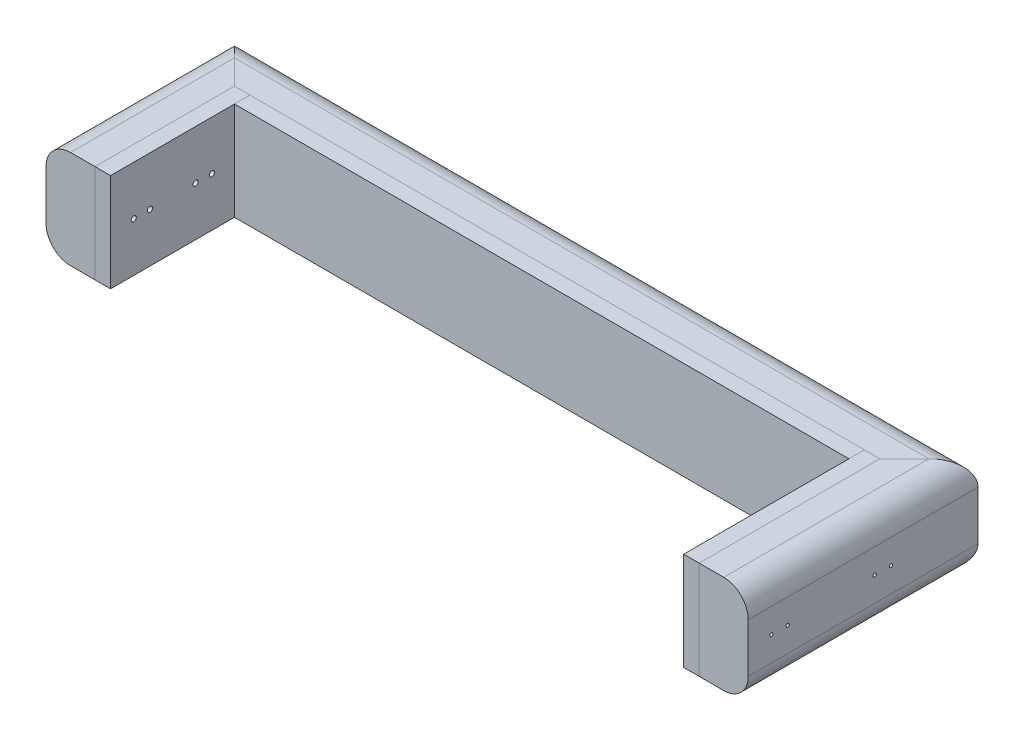
from build123d import *

# Parameters (mm, degrees)
SKETCH1_W                                     = 755.65
SKETCH1_H                                     = 19.05
BOSS_EXTRUDE1_DEPTH                           = 60.325
SKETCH2_W                                     = 19.05
SKETCH2_H                                     = 171.45
BOSS_EXTRUDE2_DEPTH                           = 60.325
SKETCH2_H_2                                   = 222.25
BOSS_EXTRUDE2_2_DEPTH                         = 60.325
CBORE_START                                   = -457.2
CBORE_FOR_0_BINDING_HEAD_MACHINE_SC_2_R       = 1.999996
CBORE_FOR_0_BINDING_HEAD_MACHINE_SCREW1_DEPTH = 914.4
CBORE_FOR_0_BINDING_HEAD_MACHINE_SC_3_O_R     = 1.999996
CBORE_FOR_0_BINDING_HEAD_MACHINE_SC_3_DEPTH   = 79.375
CBORE_START_2                                 = -382.5875
CBORE_FOR_0_BINDING_HEAD_MACHINE_SC_4_O_R     = 3.175
CBORE_FOR_0_BINDING_HEAD_MACHINE_SC_4_O_R_2   = 1.999996
CBORE_FOR_0_BINDING_HEAD_MACHINE_SC_4_DEPTH   = 765.175
CBORE_FOR_0_BINDING_HEAD_MACHINE_SC_5_O_R     = 3.175
CBORE_FOR_0_BINDING_HEAD_MACHINE_SC_5_O_R_2   = 1.999996
CBORE_FOR_0_BINDING_HEAD_MACHINE_SC_5_DEPTH   = 4.7625
CBORE_START_3                                 = 377.825
CBORE_FOR_0_BINDING_HEAD_MACHINE_SC_6_O_R     = 3.175
CBORE_FOR_0_BINDING_HEAD_MACHINE_SC_6_O_R_2   = 1.999996
CBORE_FOR_0_BINDING_HEAD_MACHINE_SC_6_DEPTH   = 4.7625


# Read off the part's stored shape, not the designer's step: CBORE for #0 Binding Head Machine Screw1
with BuildPart() as part:
    # Sketch1 → Boss-Extrude1 (new, symmetric)
    with BuildSketch(Plane(origin=(0, 0, 0), x_dir=(1, 0, 0), z_dir=(0, 1, 0))):
        Rectangle(SKETCH1_W, SKETCH1_H)
    extrude(amount=BOSS_EXTRUDE1_DEPTH, both=True)


with BuildPart() as body_2:
    # Sketch2 → Boss-Extrude2 (new, symmetric)
    with BuildSketch(Plane(origin=(0, 0, 0), x_dir=(1, 0, 0), z_dir=(0, 1, 0))):
        with Locations((-387.35, -76.2)):
            Rectangle(SKETCH2_W, SKETCH2_H)
    extrude(amount=BOSS_EXTRUDE2_DEPTH, both=True)


with BuildPart() as body_3:
    # Sketch2 → Boss-Extrude2 2 (new, symmetric)
    with BuildSketch(Plane(origin=(0, 0, 0), x_dir=(1, 0, 0), z_dir=(0, 1, 0))):
        with Locations((387.35, -101.6)):
            Rectangle(SKETCH2_W, SKETCH2_H_2)
    extrude(amount=BOSS_EXTRUDE2_2_DEPTH, both=True)


with BuildPart() as body_4:
    # Sweep1: sweep along a path in Sketch4
    with BuildLine(Plane(origin=(0, 0, 0), x_dir=(1, 0, 0), z_dir=(0, 1, 0))) as sweep1_path:
        Line((-396.875, -161.925), (-396.875, 9.525))
        Line((-396.875, 9.525), (396.875, 9.525))
        Line((396.875, 9.525), (396.875, -212.725))
    # Sketch3 → Sweep1 (sweep)
    with BuildSketch(Plane.XY.offset(161.925)):
        with BuildLine():
            Line((-396.875, 60.325), (-427.0375, 60.325))
            ThreePointArc((-427.0375, 60.325), (-448.365608288, 51.490608288), (-457.2, 30.1625))
            Line((-457.2, 30.1625), (-457.2, -30.1625))
            ThreePointArc((-457.2, -30.1625), (-448.365608288, -51.490608288), (-427.0375, -60.325))
            Line((-427.0375, -60.325), (-396.875, -60.325))
            Line((-396.875, -60.325), (-396.875, 60.325))
        make_face()
    sweep(path=sweep1_path.line, transition=Transition.RIGHT)


with BuildPart() as cbore_for_0_binding_head_machine_screw1_tool:
    # CBORE for _0 Binding Head Machine Sc 2 → CBORE for #0 Binding Head Machine Screw1 (new body)
    with BuildSketch(Plane.YZ.offset(CBORE_START)):
        with Locations((0, 184.225)):
            Circle(CBORE_FOR_0_BINDING_HEAD_MACHINE_SC_2_R)
        with Locations((0, 164.225)):
            Circle(CBORE_FOR_0_BINDING_HEAD_MACHINE_SC_2_R)
        with Locations((0, 57.225)):
            Circle(CBORE_FOR_0_BINDING_HEAD_MACHINE_SC_2_R)
        with Locations((0, 37.225)):
            Circle(CBORE_FOR_0_BINDING_HEAD_MACHINE_SC_2_R)
    extrude(amount=CBORE_FOR_0_BINDING_HEAD_MACHINE_SCREW1_DEPTH)


with BuildPart() as body_2_1:
    add(body_2.part)

    # CBORE for #0 Binding Head Machine Screw1: cut by cbore_for_0_binding_head_machine_screw1_tool
    add(cbore_for_0_binding_head_machine_screw1_tool.part, mode=Mode.SUBTRACT)


with BuildPart() as body_3_1:
    add(body_3.part)

    # CBORE for #0 Binding Head Machine Screw1: cut by cbore_for_0_binding_head_machine_screw1_tool
    add(cbore_for_0_binding_head_machine_screw1_tool.part, mode=Mode.SUBTRACT)


with BuildPart() as body_4_1:
    add(body_4.part)

    # CBORE for #0 Binding Head Machine Screw1: cut by cbore_for_0_binding_head_machine_screw1_tool
    add(cbore_for_0_binding_head_machine_screw1_tool.part, mode=Mode.SUBTRACT)


with BuildPart() as cbore_for_0_binding_head_machine_sc_3_tool:
    # CBORE for _0 Binding Head Machine Sc 3 o → CBORE for _0 Binding Head Machine Sc 3 (new body)
    with BuildSketch(Plane.YZ.offset(CBORE_START)):
        with Locations((0, 133.425)):
            Circle(CBORE_FOR_0_BINDING_HEAD_MACHINE_SC_3_O_R)
        with Locations((0, 113.425)):
            Circle(CBORE_FOR_0_BINDING_HEAD_MACHINE_SC_3_O_R)
    extrude(amount=CBORE_FOR_0_BINDING_HEAD_MACHINE_SC_3_DEPTH)


with BuildPart() as body_2_2:
    add(body_2_1.part)

    # CBORE for _0 Binding Head Machine Sc 3: cut by cbore_for_0_binding_head_machine_sc_3_tool
    add(cbore_for_0_binding_head_machine_sc_3_tool.part, mode=Mode.SUBTRACT)


with BuildPart() as body_4_2:
    add(body_4_1.part)

    # CBORE for _0 Binding Head Machine Sc 3: cut by cbore_for_0_binding_head_machine_sc_3_tool
    add(cbore_for_0_binding_head_machine_sc_3_tool.part, mode=Mode.SUBTRACT)


with BuildPart() as cbore_for_0_binding_head_machine_sc_4_tool:
    # CBORE for _0 Binding Head Machine Sc 4 o → CBORE for _0 Binding Head Machine Sc 4 (new body)
    # profile 1 of 3: a face of its own
    with BuildSketch(Plane.YZ.offset(CBORE_START_2)):
        with Locations((0, 184.225)):
            Circle(CBORE_FOR_0_BINDING_HEAD_MACHINE_SC_4_O_R)
        with Locations((0, 184.225)):
            Circle(CBORE_FOR_0_BINDING_HEAD_MACHINE_SC_4_O_R_2, mode=Mode.SUBTRACT)
    # profile 2 of 3: a face of its own
    with BuildSketch(Plane.YZ.offset(CBORE_START_2)):
        with Locations((0, 57.225)):
            Circle(CBORE_FOR_0_BINDING_HEAD_MACHINE_SC_4_O_R)
        with Locations((0, 57.225)):
            Circle(CBORE_FOR_0_BINDING_HEAD_MACHINE_SC_4_O_R_2, mode=Mode.SUBTRACT)
    # profile 3 of 3: a face of its own
    with BuildSketch(Plane.YZ.offset(CBORE_START_2)):
        with Locations((0, 37.225)):
            Circle(CBORE_FOR_0_BINDING_HEAD_MACHINE_SC_4_O_R)
        with Locations((0, 37.225)):
            Circle(CBORE_FOR_0_BINDING_HEAD_MACHINE_SC_4_O_R_2, mode=Mode.SUBTRACT)
    extrude(amount=CBORE_FOR_0_BINDING_HEAD_MACHINE_SC_4_DEPTH)


with BuildPart() as body_2_3:
    add(body_2_2.part)

    # CBORE for _0 Binding Head Machine Sc 4: cut by cbore_for_0_binding_head_machine_sc_4_tool
    add(cbore_for_0_binding_head_machine_sc_4_tool.part, mode=Mode.SUBTRACT)

    # CBORE for _0 Binding Head Machine Sc 5 o → CBORE for _0 Binding Head Machine Sc 5 (cut)
    # profile 1 of 2: a face of its own
    with BuildSketch(Plane.YZ.offset(CBORE_START_2)):
        with Locations((0, 133.425)):
            Circle(CBORE_FOR_0_BINDING_HEAD_MACHINE_SC_5_O_R)
        with Locations((0, 133.425)):
            Circle(CBORE_FOR_0_BINDING_HEAD_MACHINE_SC_5_O_R_2, mode=Mode.SUBTRACT)
    # profile 2 of 2: a face of its own
    with BuildSketch(Plane.YZ.offset(CBORE_START_2)):
        with Locations((0, 113.425)):
            Circle(CBORE_FOR_0_BINDING_HEAD_MACHINE_SC_5_O_R)
        with Locations((0, 113.425)):
            Circle(CBORE_FOR_0_BINDING_HEAD_MACHINE_SC_5_O_R_2, mode=Mode.SUBTRACT)
    extrude(amount=CBORE_FOR_0_BINDING_HEAD_MACHINE_SC_5_DEPTH, mode=Mode.SUBTRACT)


with BuildPart() as body_3_2:
    add(body_3_1.part)

    # CBORE for _0 Binding Head Machine Sc 4: cut by cbore_for_0_binding_head_machine_sc_4_tool
    add(cbore_for_0_binding_head_machine_sc_4_tool.part, mode=Mode.SUBTRACT)

    # CBORE for _0 Binding Head Machine Sc 6 o → CBORE for _0 Binding Head Machine Sc 6 (cut)
    with BuildSketch(Plane.YZ.offset(CBORE_START_3)):
        with Locations((0, 164.225)):
            Circle(CBORE_FOR_0_BINDING_HEAD_MACHINE_SC_6_O_R)
        with Locations((0, 164.225)):
            Circle(CBORE_FOR_0_BINDING_HEAD_MACHINE_SC_6_O_R_2, mode=Mode.SUBTRACT)
    extrude(amount=CBORE_FOR_0_BINDING_HEAD_MACHINE_SC_6_DEPTH, mode=Mode.SUBTRACT)


solid = Compound([part.part, body_4_2.part, body_2_3.part, body_3_2.part])
